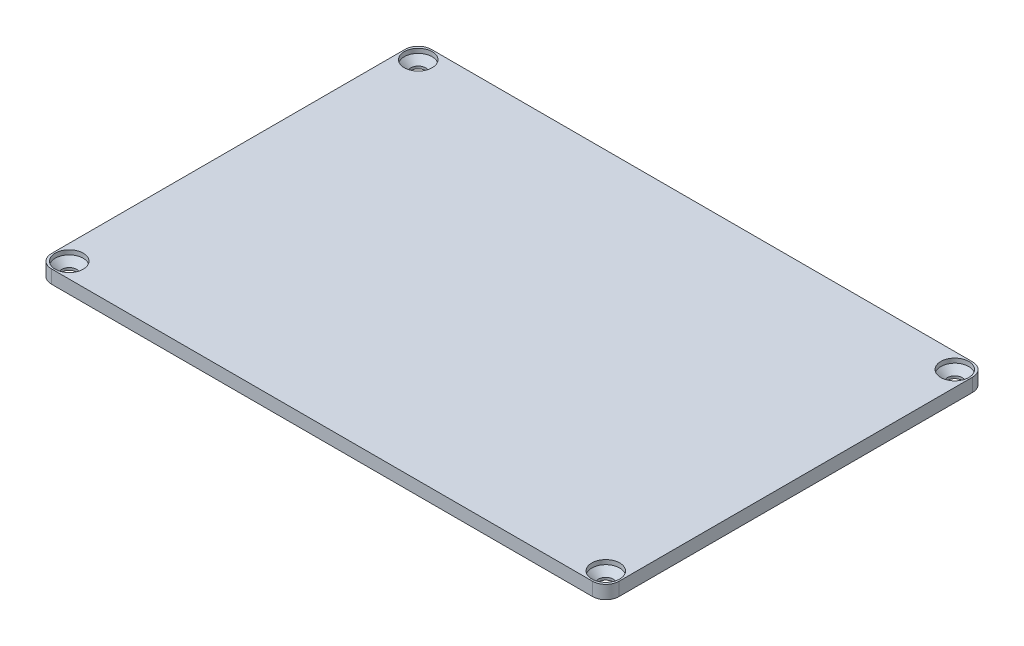
from build123d import *

# Parameters (mm, degrees)
SKETCH1_W                                      = 128
SKETCH1_H                                      = 85.7
BOSS_EXTRUDE1_DEPTH                            = 3
CSK_FOR_M3_FLAT_HEAD_MACHINE_SCREW1_AT_2_COUNT = 2
CSK_FOR_M3_FLAT_HEAD_MACHINE_SCREW1_AT_2_PITCH = 121
CSK_FOR_M3_FLAT_HEAD_MACHINE_SCREW1_AT_3_COUNT = 2
CSK_FOR_M3_FLAT_HEAD_MACHINE_SCREW1_AT_3_PITCH = 144.342266852
CSK_FOR_M3_FLAT_HEAD_MACHINE_SCREW1_AT_4_COUNT = 2
CSK_FOR_M3_FLAT_HEAD_MACHINE_SCREW1_AT_4_PITCH = 78.7
FILLET1_R                                      = 3


with BuildPart() as part:
    # Sketch1 → Boss-Extrude1 (new body)
    with BuildSketch(Plane(origin=(0, 0, 0), x_dir=(1, 0, 0), z_dir=(0, 1, 0))):
        Rectangle(SKETCH1_W, SKETCH1_H)
    extrude(amount=BOSS_EXTRUDE1_DEPTH)

    # Sketch3 → CSK for M3 Flat Head Machine Screw1 (revolve, cut)
    with BuildSketch(Plane(origin=(-60.5, 3, -39.35), x_dir=(0, 0, 1), z_dir=(1, 0, 0))):
        Polygon((0, 0), (0, 4.021463052), (1.7, 3), (1.7, 2.45), (3.15, 1), (3.15, 0), align=None)
    csk_for_m3_flat_head_machine_screw1 = revolve(axis=Axis((-60.5, 9.35, -39.35), (0, -1, 0)), mode=Mode.SUBTRACT)

    # CSK for M3 Flat Head Machine Screw1 at 2: CSK for M3 Flat Head Machine Screw1 ×2
    with Locations(*[(i * CSK_FOR_M3_FLAT_HEAD_MACHINE_SCREW1_AT_2_PITCH, 0, 0) for i in range(1, CSK_FOR_M3_FLAT_HEAD_MACHINE_SCREW1_AT_2_COUNT)]):
        add(csk_for_m3_flat_head_machine_screw1, mode=Mode.SUBTRACT)

    # CSK for M3 Flat Head Machine Screw1 at 3: CSK for M3 Flat Head Machine Screw1 ×2
    with Locations(*[Vector(0.8382852967384159, 0, 0.54523184176292) * (i * CSK_FOR_M3_FLAT_HEAD_MACHINE_SCREW1_AT_3_PITCH) for i in range(1, CSK_FOR_M3_FLAT_HEAD_MACHINE_SCREW1_AT_3_COUNT)]):
        add(csk_for_m3_flat_head_machine_screw1, mode=Mode.SUBTRACT)

    # CSK for M3 Flat Head Machine Screw1 at 4: CSK for M3 Flat Head Machine Screw1 ×2
    with Locations(*[(0, 0, i * CSK_FOR_M3_FLAT_HEAD_MACHINE_SCREW1_AT_4_PITCH) for i in range(1, CSK_FOR_M3_FLAT_HEAD_MACHINE_SCREW1_AT_4_COUNT)]):
        add(csk_for_m3_flat_head_machine_screw1, mode=Mode.SUBTRACT)

    # Fillet1
    fillet1_edges = [part.edges().sort_by_distance(p)[0] for p in [
        (64, 1.5, -42.85),
        (64, 1.5, 42.85),
        (-64, 1.5, -42.85),
        (-64, 1.5, 42.85),
    ]]
    fillet(fillet1_edges, radius=FILLET1_R)


solid = part.part
